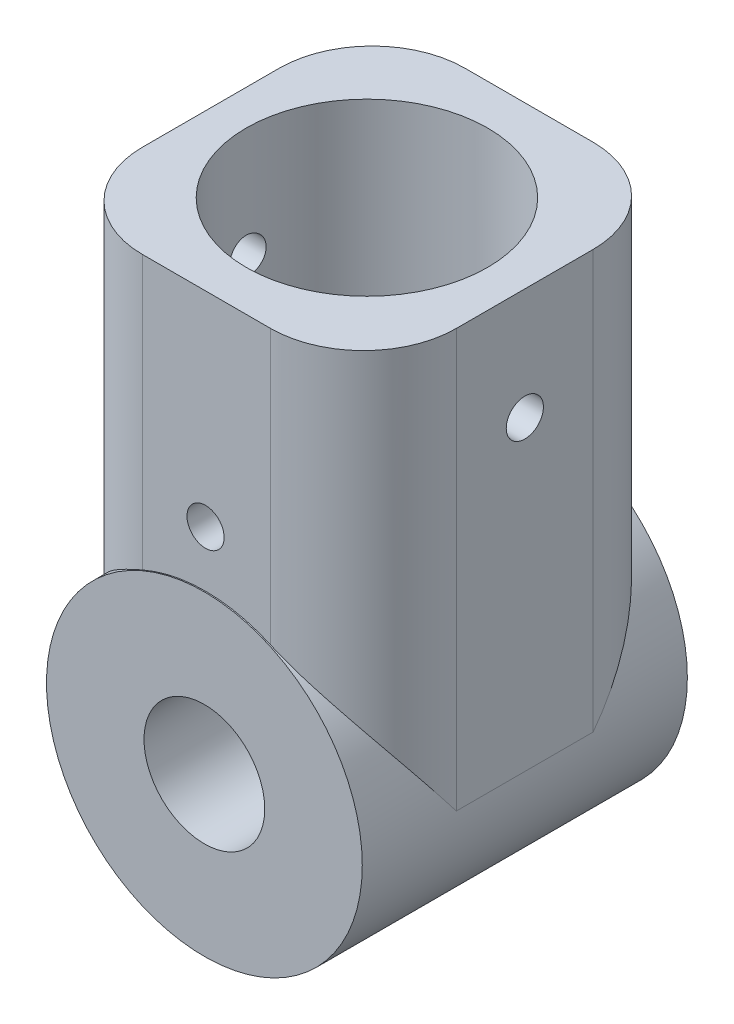
from build123d import *
from build123d.topology import SkipClean

# Parameters (mm, degrees)
SKETCH_1_R           = 17
SKETCH_1_R_2         = 6.5
EXTRUDE_2_DEPTH      = 35
SKETCH_3_W           = 33.795275063
SKETCH_3_H           = 34.72803434
SKETCH_3_R           = 13
EXTRUDE_7_DEPTH      = 45
SKETCH_4_R           = 6.5
CUT_EXTRUDE_1_DEPTH  = 60.489495005
SKETCH_12_R          = 2
CUT_EXTRUDE_11_DEPTH = 45
SKETCH_15_R          = 2
CUT_EXTRUDE_12_DEPTH = 45
FILLET_4_R           = 10
SKETCH_20_R          = 13
CUT_EXTRUDE_18_DEPTH = 31
EXTRUDE_START        = 1
SKETCH_25_R          = 13
EXTRUDE_10_DEPTH     = 1


with BuildPart() as part:
    # Эскиз1 → Бобышка-Вытянуть2 (new body)
    with BuildSketch(Plane.XY):
        Circle(SKETCH_1_R)
        Circle(SKETCH_1_R_2, mode=Mode.SUBTRACT)
    extrude(amount=EXTRUDE_2_DEPTH)

    # Эскиз3 → Бобышка-Вытянуть7 (add)
    with BuildSketch(Plane(origin=(0, 45, 0), x_dir=(1, 0, 0), z_dir=(0, 1, 0))):
        with Locations((0.102362468, -17.511098906)):
            Rectangle(SKETCH_3_W, SKETCH_3_H)
        with Locations(Location((0, -17.5, 0), (0, 0, 270))):
            Circle(SKETCH_3_R, mode=Mode.SUBTRACT)
    extrude(amount=-EXTRUDE_7_DEPTH)

    # Эскиз4 → Вырез-Вытянуть1 (cut, through all)
    with BuildSketch(Plane(origin=(0, 0, 0), x_dir=(-1, 0, 0), z_dir=(0, 0, -1))):
        with Locations(Location((0, 0, 0), (0, 0, 180))):
            Circle(SKETCH_4_R)
    extrude(amount=-CUT_EXTRUDE_1_DEPTH, mode=Mode.SUBTRACT)

    # Эскиз12 → Вырез-Вытянуть11 (cut)
    with BuildSketch(Plane(origin=(0, 0, 0), x_dir=(-1, 0, 0), z_dir=(0, 0, -1))):
        with Locations((0, 23)):
            Circle(SKETCH_12_R)
    extrude(amount=-CUT_EXTRUDE_11_DEPTH, mode=Mode.SUBTRACT)

    # Эскиз15 → Вырез-Вытянуть12 (cut)
    with BuildSketch(Plane.ZY.offset(16.795275063)):
        with Locations((17.5, 33)):
            Circle(SKETCH_15_R)
    extrude(amount=-CUT_EXTRUDE_12_DEPTH, mode=Mode.SUBTRACT)

    # Скругление4
    # the kernel refuses this fillet: 10 mm, written as the material it takes off along each edge
    with BuildSketch(Plane(origin=(-16.795275063, 70, 34.875116076), x_dir=(1, 0, 0), z_dir=(0, -1, 0))) as fillet_4_piece_1_section:
        with BuildLine():
            CenterArc((FILLET_4_R, -FILLET_4_R), FILLET_4_R, 90, 90)
            Line((0, -FILLET_4_R), (0, 0))
            Line((0, 0), (FILLET_4_R, 0))
        make_face()
    fillet_4_piece_1 = extrude(amount=92.369651061, mode=Mode.PRIVATE)
    fillet_4_piece_1 = fillet_4_piece_1 - Plane(origin=(0, 0, 32.54483178), x_dir=(1, 0, 0), z_dir=(0, 0, -1)) * Cylinder(17, 225, mode=Mode.PRIVATE)
    add(fillet_4_piece_1, mode=Mode.SUBTRACT)
    with BuildSketch(Plane(origin=(17, 70, 0.147081736), x_dir=(0, 0, 1), z_dir=(0, -1, 0))) as fillet_4_piece_2_section:
        with BuildLine():
            CenterArc((FILLET_4_R, FILLET_4_R), FILLET_4_R, 180, 90)
            Line((0, FILLET_4_R), (0, 0))
            Line((0, 0), (FILLET_4_R, 0))
        make_face()
    fillet_4_piece_2 = extrude(amount=95, mode=Mode.PRIVATE)
    fillet_4_piece_2 = fillet_4_piece_2 - Plane(origin=(0, 0, 2.486350956), x_dir=(1, 0, 0), z_dir=(0, 0, -1)) * Cylinder(17, 230, mode=Mode.PRIVATE)
    add(fillet_4_piece_2, mode=Mode.SUBTRACT)
    with BuildSketch(Plane(origin=(17, 70, 34.875116076), x_dir=(0, 0, -1), z_dir=(0, -1, 0))) as fillet_4_piece_3_section:
        with BuildLine():
            CenterArc((FILLET_4_R, -FILLET_4_R), FILLET_4_R, 90, 90)
            Line((0, -FILLET_4_R), (0, 0))
            Line((0, 0), (FILLET_4_R, 0))
        make_face()
    fillet_4_piece_3 = extrude(amount=95, mode=Mode.PRIVATE)
    fillet_4_piece_3 = fillet_4_piece_3 - Plane(origin=(0, 0, 32.535846855), x_dir=(1, 0, 0), z_dir=(0, 0, -1)) * Cylinder(17, 230, mode=Mode.PRIVATE)
    add(fillet_4_piece_3, mode=Mode.SUBTRACT)
    with BuildSketch(Plane(origin=(-16.795275063, 70, 0.147081736), x_dir=(0, 0, 1), z_dir=(0, -1, 0))) as fillet_4_piece_4_section:
        with BuildLine():
            CenterArc((FILLET_4_R, -FILLET_4_R), FILLET_4_R, 90, 90)
            Line((0, -FILLET_4_R), (0, 0))
            Line((0, 0), (FILLET_4_R, 0))
        make_face()
    fillet_4_piece_4 = extrude(amount=92.369651061, mode=Mode.PRIVATE)
    fillet_4_piece_4 = fillet_4_piece_4 - Plane(origin=(0, 0, 2.477367304), x_dir=(1, 0, 0), z_dir=(0, 0, -1)) * Cylinder(17, 225, mode=Mode.PRIVATE)
    add(fillet_4_piece_4, mode=Mode.SUBTRACT)

    # Эскиз20 → Вырез-Вытянуть18 (cut)
    with SkipClean():  # the faces are left unmerged after this step: merging them gives an invalid solid
        with BuildSketch(Plane(origin=(0, 45, 0), x_dir=(1, 0, 0), z_dir=(0, 1, 0))):
            with Locations(Location((0, -17.5, 0), (0, 0, 270))):
                Circle(SKETCH_20_R)
        extrude(amount=-CUT_EXTRUDE_18_DEPTH, mode=Mode.SUBTRACT)

    # Эскиз25 → Бобышка-Вытянуть10 (add)
    with BuildSketch(Plane(origin=(0, 14, 0), x_dir=(1, 0, 0), z_dir=(0, 1, 0)).offset(EXTRUDE_START)):
        with Locations(Location((0, -17.5, 0), (0, 0, 270))):
            Circle(SKETCH_25_R)
    extrude(amount=-EXTRUDE_10_DEPTH)


solid = part.part
